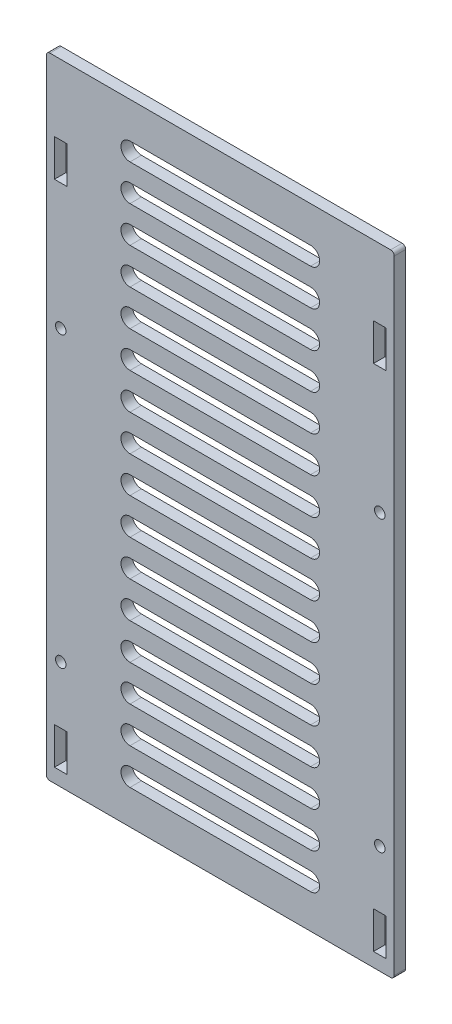
from build123d import *

# Parameters (mm, degrees)
STOCK_TORSO_FRONT_PLATE_1_START       = -1.5875
STOCK_TORSO_FRONT_PLATE_1_OUTLINE_W   = 96.34
STOCK_TORSO_FRONT_PLATE_1_OUTLINE_H   = 174.5
STOCK_TORSO_FRONT_PLATE_1_OUTLINE_W_2 = 3.4925
STOCK_TORSO_FRONT_PLATE_1_OUTLINE_H_2 = 10.25
STOCK_TORSO_FRONT_PLATE_1_OUTLINE_R   = 1.45
STOCK_TORSO_FRONT_PLATE_1_DEPTH       = 3.175
CUT_EXTRUDE1_DEPTH                    = 158.576741701
LPATTERN1_COUNT                       = 16
LPATTERN1_PITCH                       = 10
FILLET1_R                             = 1


# Read off the part's stored shape, not the designer's step: Stock-torso_front_plate-1
with BuildPart() as part:
    # Stock-torso_front_plate-1 outline → Stock-torso_front_plate-1 (new body)
    with BuildSketch(Plane.XY.offset(STOCK_TORSO_FRONT_PLATE_1_START)):
        with Locations((0, -62.75)):
            Rectangle(STOCK_TORSO_FRONT_PLATE_1_OUTLINE_W, STOCK_TORSO_FRONT_PLATE_1_OUTLINE_H)
        with Locations((-44.17, -141)):
            Rectangle(STOCK_TORSO_FRONT_PLATE_1_OUTLINE_W_2, STOCK_TORSO_FRONT_PLATE_1_OUTLINE_H_2, mode=Mode.SUBTRACT)
        with Locations((-44.17, -120)):
            Circle(STOCK_TORSO_FRONT_PLATE_1_OUTLINE_R, mode=Mode.SUBTRACT)
        with Locations((44.17, -141)):
            Rectangle(STOCK_TORSO_FRONT_PLATE_1_OUTLINE_W_2, STOCK_TORSO_FRONT_PLATE_1_OUTLINE_H_2, mode=Mode.SUBTRACT)
        with Locations((44.17, -120)):
            Circle(STOCK_TORSO_FRONT_PLATE_1_OUTLINE_R, mode=Mode.SUBTRACT)
        with Locations((-44.17, -40)):
            Circle(STOCK_TORSO_FRONT_PLATE_1_OUTLINE_R, mode=Mode.SUBTRACT)
        with Locations((-44.17, 0)):
            Rectangle(STOCK_TORSO_FRONT_PLATE_1_OUTLINE_W_2, STOCK_TORSO_FRONT_PLATE_1_OUTLINE_H_2, mode=Mode.SUBTRACT)
        with Locations((44.17, -40)):
            Circle(STOCK_TORSO_FRONT_PLATE_1_OUTLINE_R, mode=Mode.SUBTRACT)
        with Locations((44.17, 0)):
            Rectangle(STOCK_TORSO_FRONT_PLATE_1_OUTLINE_W_2, STOCK_TORSO_FRONT_PLATE_1_OUTLINE_H_2, mode=Mode.SUBTRACT)
    extrude(amount=STOCK_TORSO_FRONT_PLATE_1_DEPTH)

    # Sketch1 → Cut-Extrude1 (cut, symmetric)
    with BuildSketch(Plane.XY.offset(1.5875)):
        with BuildLine():
            Line((-25, 14.5), (25, 14.5))
            ThreePointArc((25, 14.5), (27.5, 12), (25, 9.5))
            Line((25, 9.5), (-25, 9.5))
            ThreePointArc((-25, 9.5), (-27.5, 12), (-25, 14.5))
        make_face()
    cut_extrude1 = extrude(amount=CUT_EXTRUDE1_DEPTH, both=True, mode=Mode.SUBTRACT)

    # LPattern1: Cut-Extrude1 ×16
    with Locations(*[(0, -i * LPATTERN1_PITCH, 0) for i in range(1, LPATTERN1_COUNT)]):
        add(cut_extrude1, mode=Mode.SUBTRACT)

    # Fillet1
    fillet1_edges = [part.edges().sort_by_distance(p)[0] for p in [
        (48.17, -150, 0),
        (-48.17, -150, 0),
        (-48.17, 24.5, 0),
        (48.17, 24.5, 0),
    ]]
    fillet(fillet1_edges, radius=FILLET1_R)


solid = part.part
